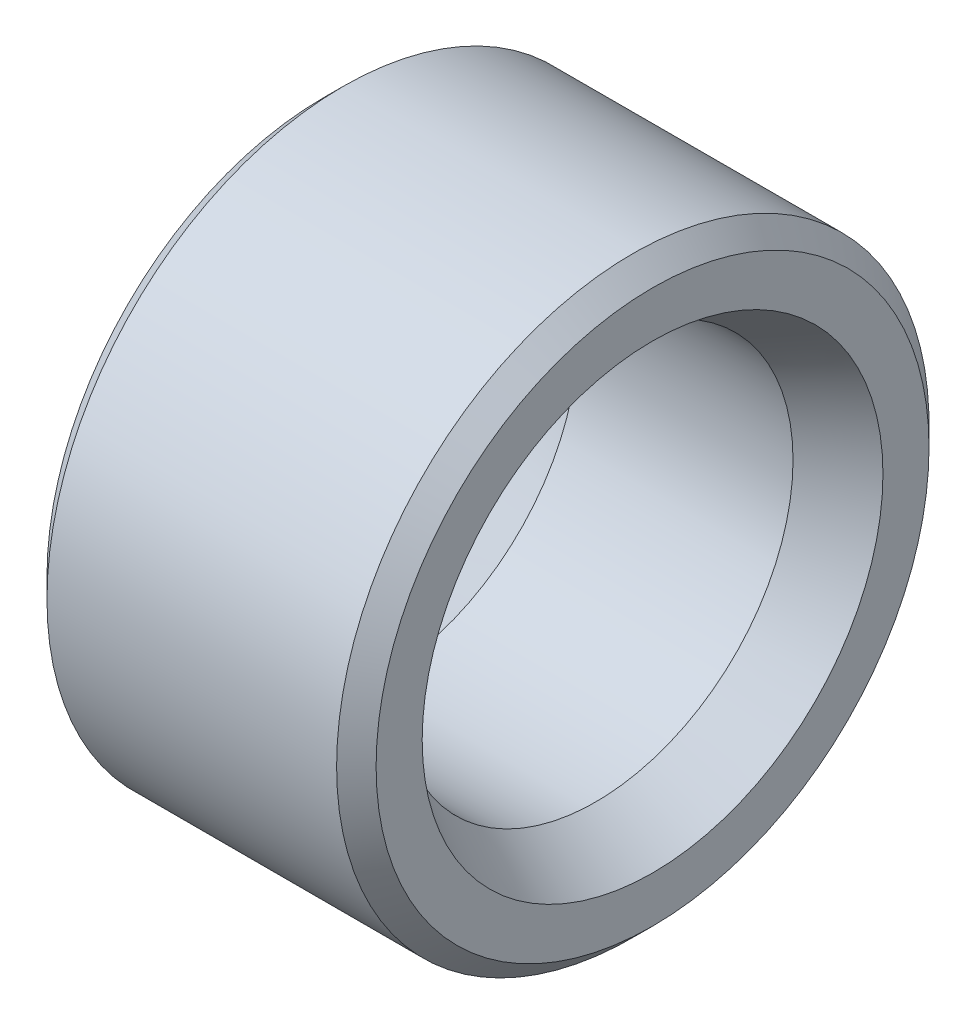
from build123d import *

# Parameters (mm, degrees)
SKETCH1_W     = 5
SKETCH1_H     = 1.5
CHAMFER1_SIZE = 0.3


with BuildPart() as part:
    # Sketch1 → Revolve1 (revolve)
    with BuildSketch(Plane.XY):
        with Locations((2.5, 3.75)):
            Rectangle(SKETCH1_W, SKETCH1_H)
    revolve(axis=Axis((0, 0, 0), (1, 0, 0)))

    # Chamfer1
    chamfer1_edges = [part.edges().sort_by_distance(p)[0] for p in [
        (5, -4.5, 0),
        (0, -4.5, 0),
    ]]
    chamfer(chamfer1_edges, length=CHAMFER1_SIZE)

    # Sketch2 → Cut-Revolve1 (revolve, cut)
    with BuildSketch(Plane.XY):
        Polygon((0, 3.5), (0, 3), (0.866025404, 3), align=None)
        Polygon((4.133974596, 3), (5, 3.5), (5, 3), align=None)
    revolve(axis=Axis((0, 0, 0), (1, 0, 0)), mode=Mode.SUBTRACT)


solid = part.part
